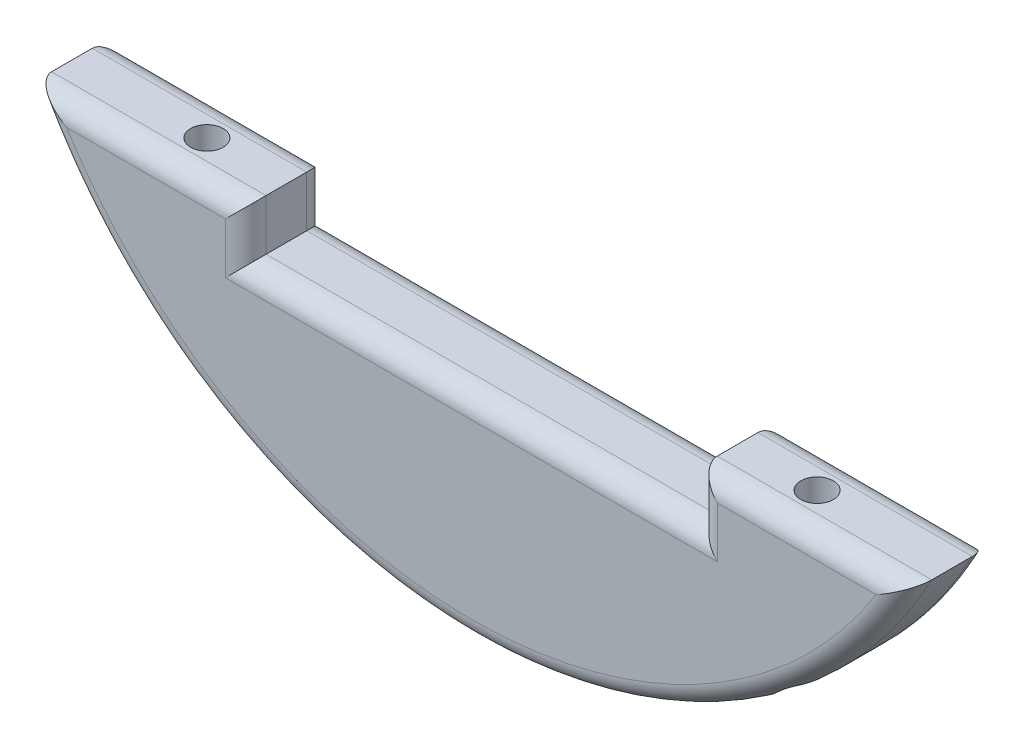
from build123d import *

# Parameters (mm, degrees)
SKETCH1_W           = 44.362146026
SKETCH1_H           = 10
BOSS_EXTRUDE1_DEPTH = 8
SKETCH2_R           = 1.6
CUT_EXTRUDE1_DEPTH  = 52.107729357
CUT_EXTRUDE2_START  = -17.925297
SKETCH3_R           = 3.05
CUT_EXTRUDE2_DEPTH  = 12.925297
FILLET1_R           = 2


with BuildPart() as part:
    # Sketch1 → Boss-Extrude1 (new body)
    with BuildSketch(Plane.XY):
        with BuildLine():
            Line((-29.953929645, -23), (-37.509998667, -23))
            ThreePointArc((-37.509998667, -23), (-35.812927639, -25.562359318), (-33.941125497, -28))
            Line((-33.941125497, -28), (-22.181073013, -28))
            Line((-22.181073013, -28), (-22.181073013, -23))
            Line((-22.181073013, -23), (-29.953929645, -23))
        make_face()
        with BuildLine():
            Line((-37.509998667, -23), (-43.266615306, -23))
            ThreePointArc((-43.266615306, -23), (0, -49), (43.266615306, -23))
            Line((43.266615306, -23), (37.509998667, -23))
            ThreePointArc((37.509998667, -23), (35.812927639, -25.562359318), (33.941125497, -28))
            ThreePointArc((33.941125497, -28), (28.503075122, -33.519765939), (22.181073013, -38))
            ThreePointArc((22.181073013, -38), (0, -44), (-22.181073013, -38))
            ThreePointArc((-22.181073013, -38), (-28.503075122, -33.519765939), (-33.941125497, -28))
            ThreePointArc((-33.941125497, -28), (-35.812927639, -25.562359318), (-37.509998667, -23))
        make_face()
        with BuildLine():
            Line((-22.181073013, -28), (-33.941125497, -28))
            ThreePointArc((-33.941125497, -28), (-28.503075122, -33.519765939), (-22.181073013, -38))
            Line((-22.181073013, -38), (-22.181073013, -28))
        make_face()
        with BuildLine():
            ThreePointArc((22.181073013, -38), (28.503075122, -33.519765939), (33.941125497, -28))
            Line((33.941125497, -28), (22.181073013, -28))
            Line((22.181073013, -28), (22.181073013, -38))
        make_face()
        with BuildLine():
            ThreePointArc((33.941125497, -28), (35.812927639, -25.562359318), (37.509998667, -23))
            Line((37.509998667, -23), (22.181073013, -23))
            Line((22.181073013, -23), (22.181073013, -28))
            Line((22.181073013, -28), (33.941125497, -28))
        make_face()
        with Locations((0, -33)):
            Rectangle(SKETCH1_W, SKETCH1_H)
        with BuildLine():
            Line((22.181073013, -38), (-22.181073013, -38))
            ThreePointArc((-22.181073013, -38), (0, -44), (22.181073013, -38))
        make_face()
    extrude(amount=BOSS_EXTRUDE1_DEPTH)

    # Sketch2 → Cut-Extrude1 (cut, through all)
    with BuildSketch(Plane(origin=(0, -23, 0), x_dir=(1, 0, 0), z_dir=(0, 1, 0))):
        with Locations(Location((-29.996615306, -4, 0), (0, 0, 270))):
            Circle(SKETCH2_R)
    cut_extrude1 = extrude(amount=-CUT_EXTRUDE1_DEPTH, mode=Mode.SUBTRACT)

    # Sketch3 → Cut-Extrude2 (cut)
    with BuildSketch(Plane(origin=(0, -23, 0), x_dir=(1, 0, 0), z_dir=(0, 1, 0)).offset(CUT_EXTRUDE2_START)):
        with Locations(Location((-29.996615306, -4, 0), (0, 0, 90))):
            Circle(SKETCH3_R)
    cut_extrude2 = extrude(amount=CUT_EXTRUDE2_DEPTH, mode=Mode.SUBTRACT)

    # Mirror1: Cut-Extrude1, Cut-Extrude2 across plane
    add(cut_extrude1.mirror(Plane(origin=(0, 0, 0), x_dir=(0, 0, 1), z_dir=(1, 0, 0))), mode=Mode.SUBTRACT)
    add(cut_extrude2.mirror(Plane(origin=(0, 0, 0), x_dir=(0, 0, 1), z_dir=(1, 0, 0))), mode=Mode.SUBTRACT)

    # Fillet1
    # the kernel refuses this fillet: 2 mm, written as the material it takes off along each edge
    with BuildSketch(Plane(origin=(22.181073013, -28, 8), x_dir=(0, -1, 0), z_dir=(-1, 0, 0))) as fillet1_piece_1:
        with BuildLine():
            CenterArc((FILLET1_R, -FILLET1_R), FILLET1_R, 90, 90)
            Line((0, -FILLET1_R), (0, 0))
            Line((0, 0), (FILLET1_R, 0))
        make_face()
    extrude(amount=44.362146026, mode=Mode.SUBTRACT)
    with BuildSketch(Plane(origin=(22.181073013, -28, 0), x_dir=(0, -1, 0), z_dir=(-1, 0, 0))) as fillet1_piece_2:
        with BuildLine():
            CenterArc((FILLET1_R, FILLET1_R), FILLET1_R, 180, 90)
            Line((0, FILLET1_R), (0, 0))
            Line((0, 0), (FILLET1_R, 0))
        make_face()
    extrude(amount=44.362146026, mode=Mode.SUBTRACT)
    with BuildSketch(Plane(origin=(22.181073013, -18, 0), x_dir=(1, 0, 0), z_dir=(0, -1, 0))) as fillet1_piece_3:
        with BuildLine():
            CenterArc((FILLET1_R, FILLET1_R), FILLET1_R, 180, 90)
            Line((0, FILLET1_R), (0, 0))
            Line((0, 0), (FILLET1_R, 0))
        make_face()
    extrude(amount=10, mode=Mode.SUBTRACT)
    with BuildSketch(Plane(origin=(-22.181073013, -28, 8), x_dir=(-1, 0, 0), z_dir=(0, 1, 0)), Plane(origin=(22.181073013, -18, 8), x_dir=(1, 0, 0), z_dir=(0, -1, 0)), Plane(origin=(-22.181073013, -28, 0), x_dir=(0, 0, 1), z_dir=(0, 1, 0))) as fillet1_piece_4:
        with BuildLine():
            CenterArc((FILLET1_R, -FILLET1_R), FILLET1_R, 90, 90)
            Line((0, -FILLET1_R), (0, 0))
            Line((0, 0), (FILLET1_R, 0))
        make_face()
    extrude(amount=10, mode=Mode.SUBTRACT)
    with BuildSketch(Plane(origin=(-17.181073013, -23, 8), x_dir=(0, -1, 0), z_dir=(-1, 0, 0)), Plane(origin=(48.266615306, -23, 8), x_dir=(0, -1, 0), z_dir=(-1, 0, 0)), Plane(origin=(-48.266615306, -23, 0), x_dir=(0, -1, 0), z_dir=(1, 0, 0))) as fillet1_piece_5:
        with BuildLine():
            CenterArc((FILLET1_R, -FILLET1_R), FILLET1_R, 90, 90)
            Line((0, -FILLET1_R), (0, 0))
            Line((0, 0), (FILLET1_R, 0))
        make_face()
    extrude(amount=31.085542293, mode=Mode.SUBTRACT)
    with BuildSketch(Plane(origin=(0, 0, 8), x_dir=(-0.9262421127905929, -0.3769291027411106, 0), z_dir=(-0.3769291027411106, 0.9262421127905929, 0))) as fillet1_piece_6:
        with BuildLine():
            CenterArc((49 - FILLET1_R, -FILLET1_R), FILLET1_R, 0, 90)
            Line((49, -FILLET1_R), (49, 0))
            Line((49, 0), (49 - FILLET1_R, 0))
        make_face()
    revolve(axis=Axis((0, 0, 8), (0, 0, 1)), revolution_arc=135.712813104, mode=Mode.SUBTRACT)
    with BuildSketch(Plane(origin=(48.266615306, -23, 0), x_dir=(0, -1, 0), z_dir=(-1, 0, 0))) as fillet1_piece_7:
        with BuildLine():
            CenterArc((FILLET1_R, FILLET1_R), FILLET1_R, 180, 90)
            Line((0, FILLET1_R), (0, 0))
            Line((0, 0), (FILLET1_R, 0))
        make_face()
    extrude(amount=31.085542293, mode=Mode.SUBTRACT)
    with BuildSketch(Plane(origin=(0, 0, 0), x_dir=(-0.9262421127905929, -0.3769291027411106, 0), z_dir=(-0.3769291027411106, 0.9262421127905929, 0))) as fillet1_piece_8:
        with BuildLine():
            CenterArc((49 - FILLET1_R, FILLET1_R), FILLET1_R, 270, 90)
            Line((49, FILLET1_R), (49, 0))
            Line((49, 0), (49 - FILLET1_R, 0))
        make_face()
    revolve(axis=Axis((0, 0, 0), (0, 0, 1)), revolution_arc=135.712813104, mode=Mode.SUBTRACT)
    with BuildSketch(Plane(origin=(22.181073013, -18, 8), x_dir=(1, 0, 0), z_dir=(0, -1, 0))) as fillet1_piece_9a_section:
        with BuildLine():
            CenterArc((FILLET1_R, -FILLET1_R), FILLET1_R, 90, 90)
            Line((0, -FILLET1_R), (0, 0))
            Line((0, 0), (FILLET1_R, 0))
        make_face()
    fillet1_piece_9a = extrude(amount=15, mode=Mode.PRIVATE)
    fillet1_piece_9a = split(fillet1_piece_9a, bisect_by=Plane(origin=(22.633863241, -28, 7.547209771), z_dir=(0, -1, 0)), keep=Keep.TOP, mode=Mode.PRIVATE)
    with BuildSketch(Plane(origin=(27.181073013, -28, 8), x_dir=(0, -1, 0), z_dir=(-1, 0, 0))) as fillet1_piece_9b_section:
        with BuildLine():
            CenterArc((FILLET1_R, -FILLET1_R), FILLET1_R, 90, 90)
            Line((0, -FILLET1_R), (0, 0))
            Line((0, 0), (FILLET1_R, 0))
        make_face()
    fillet1_piece_9b = extrude(amount=49.362146026, mode=Mode.PRIVATE)
    fillet1_piece_9b = split(fillet1_piece_9b, bisect_by=Plane(origin=(22.181073013, -28.452790229, 7.547209771), z_dir=(1, 0, 0)), keep=Keep.TOP, mode=Mode.PRIVATE)
    fillet1_piece_9 = fillet1_piece_9a & fillet1_piece_9b
    add(fillet1_piece_9, mode=Mode.SUBTRACT)
    with BuildSketch(Plane(origin=(22.181073013, -28, 8), x_dir=(0, -1, 0), z_dir=(-1, 0, 0))) as fillet1_piece_10a_section:
        with BuildLine():
            CenterArc((FILLET1_R, -FILLET1_R), FILLET1_R, 90, 90)
            Line((0, -FILLET1_R), (0, 0))
            Line((0, 0), (FILLET1_R, 0))
        make_face()
    fillet1_piece_10a = extrude(amount=49.362146026, mode=Mode.PRIVATE)
    fillet1_piece_10a = split(fillet1_piece_10a, bisect_by=Plane(origin=(-22.181073013, -28.452790229, 7.547209771), z_dir=(-1, 0, 0)), keep=Keep.TOP, mode=Mode.PRIVATE)
    with BuildSketch(Plane(origin=(-22.181073013, -33, 8), x_dir=(-1, 0, 0), z_dir=(0, 1, 0))) as fillet1_piece_10b_section:
        with BuildLine():
            CenterArc((FILLET1_R, -FILLET1_R), FILLET1_R, 90, 90)
            Line((0, -FILLET1_R), (0, 0))
            Line((0, 0), (FILLET1_R, 0))
        make_face()
    fillet1_piece_10b = extrude(amount=15, mode=Mode.PRIVATE)
    fillet1_piece_10b = split(fillet1_piece_10b, bisect_by=Plane(origin=(-22.633863241, -28, 7.547209771), z_dir=(0, -1, 0)), keep=Keep.TOP, mode=Mode.PRIVATE)
    fillet1_piece_10 = fillet1_piece_10a & fillet1_piece_10b
    add(fillet1_piece_10, mode=Mode.SUBTRACT)
    with BuildSketch(Plane(origin=(22.181073013, -18, 0), x_dir=(1, 0, 0), z_dir=(0, -1, 0))) as fillet1_piece_11a_section:
        with BuildLine():
            CenterArc((FILLET1_R, FILLET1_R), FILLET1_R, 180, 90)
            Line((0, FILLET1_R), (0, 0))
            Line((0, 0), (FILLET1_R, 0))
        make_face()
    fillet1_piece_11a = extrude(amount=15, mode=Mode.PRIVATE)
    fillet1_piece_11a = split(fillet1_piece_11a, bisect_by=Plane(origin=(22.633863241, -28, 0.452790229), z_dir=(0, -1, 0)), keep=Keep.TOP, mode=Mode.PRIVATE)
    with BuildSketch(Plane(origin=(27.181073013, -28, 0), x_dir=(0, -1, 0), z_dir=(-1, 0, 0))) as fillet1_piece_11b_section:
        with BuildLine():
            CenterArc((FILLET1_R, FILLET1_R), FILLET1_R, 180, 90)
            Line((0, FILLET1_R), (0, 0))
            Line((0, 0), (FILLET1_R, 0))
        make_face()
    fillet1_piece_11b = extrude(amount=49.362146026, mode=Mode.PRIVATE)
    fillet1_piece_11b = split(fillet1_piece_11b, bisect_by=Plane(origin=(22.181073013, -28.452790229, 0.452790229), z_dir=(1, 0, 0)), keep=Keep.TOP, mode=Mode.PRIVATE)
    fillet1_piece_11 = fillet1_piece_11a & fillet1_piece_11b
    add(fillet1_piece_11, mode=Mode.SUBTRACT)
    with BuildSketch(Plane(origin=(-22.181073013, -33, 0), x_dir=(0, 0, 1), z_dir=(0, 1, 0))) as fillet1_piece_12a_section:
        with BuildLine():
            CenterArc((FILLET1_R, -FILLET1_R), FILLET1_R, 90, 90)
            Line((0, -FILLET1_R), (0, 0))
            Line((0, 0), (FILLET1_R, 0))
        make_face()
    fillet1_piece_12a = extrude(amount=15, mode=Mode.PRIVATE)
    fillet1_piece_12a = split(fillet1_piece_12a, bisect_by=Plane(origin=(-22.633863241, -28, 0.452790229), z_dir=(0, -1, 0)), keep=Keep.TOP, mode=Mode.PRIVATE)
    with BuildSketch(Plane(origin=(22.181073013, -28, 0), x_dir=(0, -1, 0), z_dir=(-1, 0, 0))) as fillet1_piece_12b_section:
        with BuildLine():
            CenterArc((FILLET1_R, FILLET1_R), FILLET1_R, 180, 90)
            Line((0, FILLET1_R), (0, 0))
            Line((0, 0), (FILLET1_R, 0))
        make_face()
    fillet1_piece_12b = extrude(amount=49.362146026, mode=Mode.PRIVATE)
    fillet1_piece_12b = split(fillet1_piece_12b, bisect_by=Plane(origin=(-22.181073013, -28.452790229, 0.452790229), z_dir=(-1, 0, 0)), keep=Keep.TOP, mode=Mode.PRIVATE)
    fillet1_piece_12 = fillet1_piece_12a & fillet1_piece_12b
    add(fillet1_piece_12, mode=Mode.SUBTRACT)


solid = part.part
